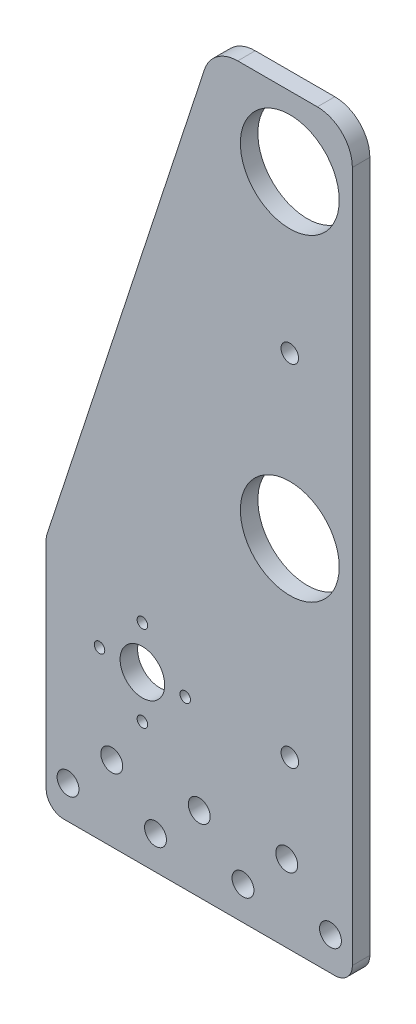
from build123d import *

# Parameters (mm, degrees)
SKETCH1_R           = 14.351
SKETCH1_R_2         = 2.54
SKETCH1_R_3         = 6.477
SKETCH1_R_4         = 1.524
SKETCH1_R_5         = 3.175
BOSS_EXTRUDE1_DEPTH = 5.08


with BuildPart() as part:
    # Sketch1 → Boss-Extrude1 (new body)
    with BuildSketch(Plane.XY):
        with BuildLine():
            Line((88.9, 205.74), (88.9, 5.08))
            ThreePointArc((88.9, 5.08), (87.412102448, 1.487897552), (83.82, 0))
            Line((83.82, 0), (5.08, 0))
            ThreePointArc((5.08, 0), (1.487897552, 1.487897552), (0, 5.08))
            Line((0, 5.08), (0, 67.619993162))
            ThreePointArc((0, 67.619993162), (0.063384098, 68.419971217), (0.25195468, 69.199986324))
            Line((0.25195468, 69.199986324), (45.969223296, 208.899986324))
            ThreePointArc((45.969223296, 208.899986324), (49.662087504, 213.965906061), (55.625313935, 215.9))
            Line((55.625313935, 215.9), (78.74, 215.9))
            ThreePointArc((78.74, 215.9), (85.924204897, 212.924204897), (88.9, 205.74))
        make_face()
        with Locations((70.739, 195.58)):
            Circle(SKETCH1_R, mode=Mode.SUBTRACT)
        with Locations((70.739, 103.378)):
            Circle(SKETCH1_R, mode=Mode.SUBTRACT)
        with Locations((70.739, 149.95398)):
            Circle(SKETCH1_R_2, mode=Mode.SUBTRACT)
        with Locations((70.739, 48.35398)):
            Circle(SKETCH1_R_2, mode=Mode.SUBTRACT)
        with Locations((27.94, 48.35398)):
            Circle(SKETCH1_R_3, mode=Mode.SUBTRACT)
        with Locations((27.94, 35.90798)):
            Circle(SKETCH1_R_4, mode=Mode.SUBTRACT)
        with Locations((15.494, 48.35398)):
            Circle(SKETCH1_R_4, mode=Mode.SUBTRACT)
        with Locations((27.94, 60.79998)):
            Circle(SKETCH1_R_4, mode=Mode.SUBTRACT)
        with Locations((40.386, 48.35398)):
            Circle(SKETCH1_R_4, mode=Mode.SUBTRACT)
        with Locations((6.35, 9.652)):
            Circle(SKETCH1_R_5, mode=Mode.SUBTRACT)
        with Locations((31.75, 9.652)):
            Circle(SKETCH1_R_5, mode=Mode.SUBTRACT)
        with Locations((57.15, 9.652)):
            Circle(SKETCH1_R_5, mode=Mode.SUBTRACT)
        with Locations((82.55, 9.652)):
            Circle(SKETCH1_R_5, mode=Mode.SUBTRACT)
        with Locations((69.85, 22.352)):
            Circle(SKETCH1_R_5, mode=Mode.SUBTRACT)
        with Locations((44.45, 21.844)):
            Circle(SKETCH1_R_5, mode=Mode.SUBTRACT)
        with Locations((19.05, 21.844)):
            Circle(SKETCH1_R_5, mode=Mode.SUBTRACT)
    extrude(amount=BOSS_EXTRUDE1_DEPTH)


solid = part.part
